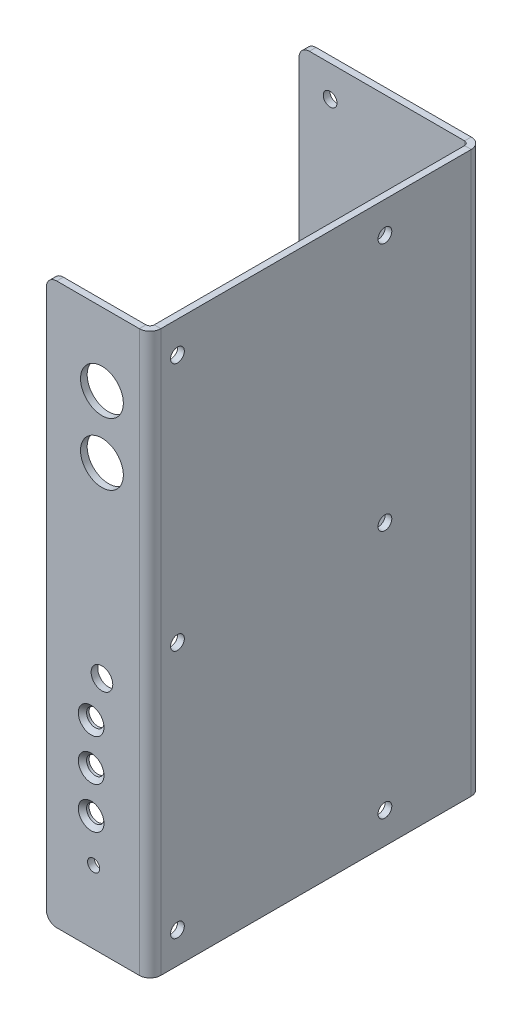
from build123d import *

# Parameters (mm, degrees)
BASE_FLANGE1_DEPTH                 = 85.725
SKETCH2_R                          = 6.5532
SKETCH2_R_2                        = 3.3147
SKETCH2_R_3                        = 2.667
SKETCH2_R_4                        = 1.8669
FCE_1_INDICATOR_HOLES_DEPTH        = 2.54
SKETCH3_R                          = 2.1082
FCE_2_BRACKET_MOUNTING_HOLES_DEPTH = 2.54
CHAMFER1_SIZE                      = 1.27
SKETCH8_R                          = 2.1082
FCE_3_BOARD_MOUNTING_HOLES_DEPTH   = 2.54
FILLET1_R                          = 3.175


# Sheet-metal steps are written as plain solids
with BuildPart() as part:
    # Sketch1 → Base-Flange1 (new, symmetric)
    with BuildSketch(Plane(origin=(0, 0, 0), x_dir=(1, 0, 0), z_dir=(0, 1, 0))):
        with BuildLine():
            Line((-31.75, -101.6), (-3.302, -101.6))
            ThreePointArc((-3.302, -101.6), (-0.967133409, -100.632866591), (0, -98.298))
            Line((0, -98.298), (0, -3.302))
            ThreePointArc((0, -3.302), (-0.967133409, -0.967133409), (-3.302, 0))
            Line((-3.302, 0), (-53.975, 0))
            Line((-53.975, 0), (-53.975, -2.032))
            Line((-53.975, -2.032), (-3.302, -2.032))
            ThreePointArc((-3.302, -2.032), (-2.403974388, -2.403974388), (-2.032, -3.302))
            Line((-2.032, -3.302), (-2.032, -98.298))
            ThreePointArc((-2.032, -98.298), (-2.403974388, -99.196025612), (-3.302, -99.568))
            Line((-3.302, -99.568), (-31.75, -99.568))
            Line((-31.75, -99.568), (-31.75, -101.6))
        make_face()
    extrude(amount=BASE_FLANGE1_DEPTH, both=True)

    # Sketch2 → FCE-1 Indicator holes (cut)
    with BuildSketch(Plane(origin=(0, 0, 101.6), x_dir=(-1, 0, 0), z_dir=(0, 0, -1))):
        with Locations(Location((14.732, 63.5, 0), (0, 0, 180))):
            Circle(SKETCH2_R)
        with Locations(Location((14.732, 44.45, 0), (0, 0, 180))):
            Circle(SKETCH2_R)
        with Locations(Location((14.732, -12.7, 0), (0, 0, 180))):
            Circle(SKETCH2_R_2)
        with Locations(Location((18.034, -25.4, 0), (0, 0, 180))):
            Circle(SKETCH2_R_3)
        with Locations(Location((18.034, -38.1, 0), (0, 0, 180))):
            Circle(SKETCH2_R_3)
        with Locations(Location((18.034, -50.8, 0), (0, 0, 180))):
            Circle(SKETCH2_R_3)
        with Locations(Location((17.272, -63.5, 0), (0, 0, 180))):
            Circle(SKETCH2_R_4)
    extrude(amount=FCE_1_INDICATOR_HOLES_DEPTH, mode=Mode.SUBTRACT)

    # Sketch3 → FCE-2 Bracket Mounting Holes (cut)
    with BuildSketch(Plane.XY.offset(2.032)):
        with Locations((-44.45, 76.2)):
            Circle(SKETCH3_R)
        with Locations((-44.45, 0)):
            Circle(SKETCH3_R)
        with Locations((-44.45, -76.2)):
            Circle(SKETCH3_R)
    extrude(amount=-FCE_2_BRACKET_MOUNTING_HOLES_DEPTH, mode=Mode.SUBTRACT)

    # Chamfer1
    chamfer1_edges = [part.edges().sort_by_distance(p)[0] for p in [
        (-20.701, -25.4, 101.6),
        (-20.701, -38.1, 101.6),
        (-20.701, -50.8, 101.6),
    ]]
    chamfer(chamfer1_edges, length=CHAMFER1_SIZE)

    # Sketch8 → FCE-3 Board Mounting Holes (cut)
    with BuildSketch(Plane.ZY.offset(2.032)):
        with Locations((93.218, 76.2)):
            Circle(SKETCH8_R)
        with Locations((93.218, 0)):
            Circle(SKETCH8_R)
        with Locations((93.218, -76.2)):
            Circle(SKETCH8_R)
        with Locations((29.718, -76.2)):
            Circle(SKETCH8_R)
        with Locations((29.718, 0)):
            Circle(SKETCH8_R)
        with Locations((29.718, 76.2)):
            Circle(SKETCH8_R)
    extrude(amount=-FCE_3_BOARD_MOUNTING_HOLES_DEPTH, mode=Mode.SUBTRACT)

    # Fillet1
    fillet1_edges = [part.edges().sort_by_distance(p)[0] for p in [
        (-31.75, -85.725, 100.584),
        (-53.975, 85.725, 1.016),
        (-31.75, 85.725, 100.584),
        (-53.975, -85.725, 1.016),
    ]]
    fillet(fillet1_edges, radius=FILLET1_R)


solid = part.part
